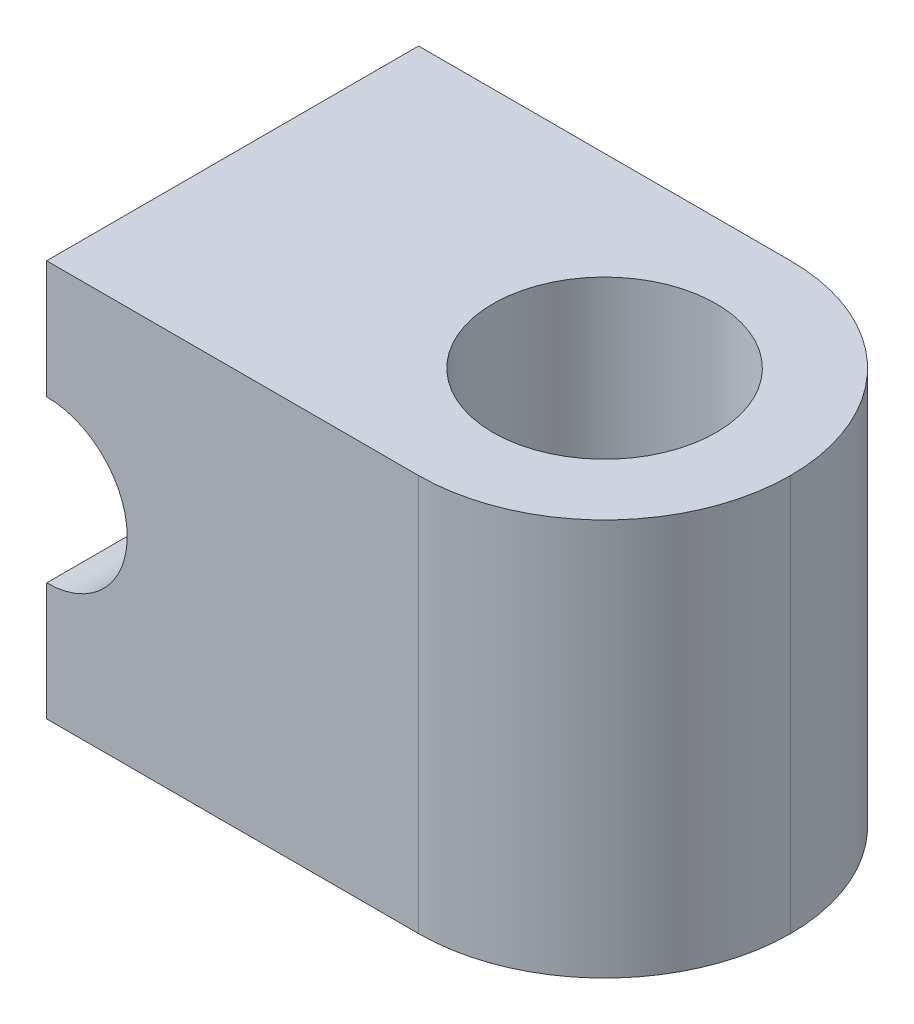
from build123d import *

# Parameters (mm, degrees)
SKETCH1_W            = 22.5
SKETCH1_H            = 7.5
BOSS_EXTRUDE1_DEPTH  = 16
SKETCH2_R            = 3.25
CUT_EXTRUDE1_DEPTH   = 29.609439002
CUT_SWEEP1_START     = -5.5
CUT_SWEEP1_DEPTH     = 5.5
M8_CLEARANCE_HOLE1_D = 9
FILLET1_R            = 7.5


# Read off the part's stored shape, not the designer's step: Cut-Sweep1
with BuildPart() as part:
    # Sketch1 → Boss-Extrude1 (new body)
    with BuildSketch(Plane(origin=(0, 0, 0), x_dir=(1, 0, 0), z_dir=(0, 1, 0))):
        with Locations((11.25, 3.75)):
            Rectangle(SKETCH1_W, SKETCH1_H)
    extrude(amount=BOSS_EXTRUDE1_DEPTH)

    # Sketch2 → Cut-Extrude1 (cut, through all)
    with BuildSketch(Plane.XY):
        with Locations((0, 8)):
            Circle(SKETCH2_R)
    extrude(amount=-CUT_EXTRUDE1_DEPTH, mode=Mode.SUBTRACT)

    # Cut-Sweep1 outline → Cut-Sweep1 (cut)
    with BuildSketch(Plane.XY.offset(CUT_SWEEP1_START)):
        with BuildLine():
            Line((0, 3.249930627), (0, 1.249434771))
            add(Edge.make_bspline(
                [(0, 1.249434771), (0.149995203, 1.25004033), (0.30688463, 1.254968997), (1.093425095, 1.310005949), (1.780407601, 1.443456641), (3.214381438, 2.014530663), (3.966417034, 2.456250234), (5.342873723, 3.766883929), (5.956791785, 4.632955322), (6.725554437, 6.74015649), (6.857452883, 7.944240799), (6.449506923, 10.330582428), (5.919057461, 11.44506695), (4.432172795, 13.221075917), (3.517243631, 13.845944042), (1.687026948, 14.610603142), (0.802645598, 14.750006388), (0, 14.75)],
                knots=[0.087190704, 0.087190704, 0.087190704, 0.087190704, 0.118471805, 0.118471805, 0.23694361, 0.23694361, 0.355415415, 0.355415415, 0.47388722, 0.47388722, 0.592359026, 0.592359026, 0.710830831, 0.710830831, 0.829302636, 0.829302636, 0.947774441, 0.947774441, 0.947774441, 0.947774441], degree=3))
            Line((0, 14.75), (0, 12.75))
            add(Edge.make_bspline(
                [(0, 3.249930627), (0.109137324, 3.250243145), (0.218715414, 3.253689733), (0.769523599, 3.292231999), (1.251212609, 3.385472533), (2.263638937, 3.788666681), (2.793426306, 4.100980011), (3.757556078, 5.019003289), (4.195566344, 5.640878482), (4.729047664, 7.103163163), (4.82290714, 7.976601279), (4.54124976, 9.62420025), (4.15661699, 10.434633992), (3.127582079, 11.66376284), (2.470103133, 12.115899669), (1.192161348, 12.64981872), (0.547543704, 12.750002903), (0, 12.75)],
                knots=[0.087942654, 0.087942654, 0.087942654, 0.087942654, 0.118471805, 0.118471805, 0.23694361, 0.23694361, 0.355415415, 0.355415415, 0.47388722, 0.47388722, 0.592359026, 0.592359026, 0.710830831, 0.710830831, 0.829302636, 0.829302636, 0.947774441, 0.947774441, 0.947774441, 0.947774441], degree=3))
        make_face()
    extrude(amount=CUT_SWEEP1_DEPTH, mode=Mode.SUBTRACT)

    # Mirror1: part across plane


with BuildPart() as part_1:
    add(part.part)
    add(part.part.mirror(Plane(origin=(0, 16, 0), x_dir=(1, 0, 0), z_dir=(0, 0, -1))))

    # M8 Clearance Hole1 (through all)
    with Locations(Plane(origin=(0, 16, 0), x_dir=(1, 0, 0), z_dir=(0, 1, 0))):
        with Locations((15, 0)):
            Hole(M8_CLEARANCE_HOLE1_D / 2)

    # Fillet1
    fillet1_edges = [part_1.edges().sort_by_distance(p)[0] for p in [
        (22.5, 8, -7.5),
        (22.5, 8, 7.5),
    ]]
    fillet(fillet1_edges, radius=FILLET1_R - 0.0001)  # a hair under: the kernel refuses the full size


solid = part_1.part
